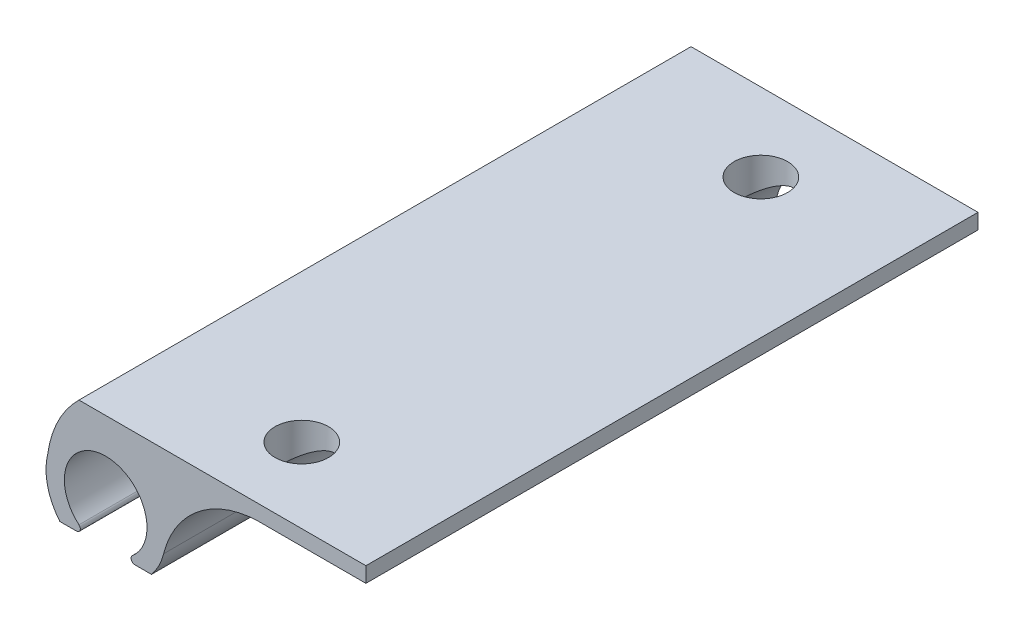
from build123d import *

# Parameters (mm, degrees)
EXTRUDE_1_DEPTH                            = 3.9
EXTRUDE_3_DEPTH                            = 20
EXTRUDE_5_DEPTH                            = 20
FILLET_1_R                                 = 0.25
FILLET_1_OF_MIRROR_2_R                     = 0.25
SKETCH_7_R                                 = 5.5
CUT_EXTRUDE_3_DEPTH                        = 69.146236458
MIRROR_3_AT_THE_SECOND_PLANE_COPY_1_SKET_R = 5.5
MIRROR_3_AT_THE_SECOND_PLANE_COPY_1_DEPTH  = 69.146236458
ESQUISSE1_W                                = 44.6
ESQUISSE1_H                                = 40
ENL_V_MAT_EXTRU_1_DEPTH                    = 1.54
ENL_V_MAT_EXTRU_2_DEPTH                    = 57.761068742
ESQUISSE3_W                                = 50
ESQUISSE3_H                                = 1.36
ENL_V_MAT_EXTRU_3_DEPTH                    = 64.372466761
ESQUISSE4_W                                = 27.815449133
ESQUISSE4_H                                = 40
ENL_V_MAT_EXTRU_4_DEPTH                    = 54.066651895
ESQUISSE5_R                                = 1.75
ENL_V_MAT_EXTRU_5_DEPTH                    = 54.198396436


with BuildPart() as part:
    # Эскиз1 → Бобышка-Вытянуть1 (new body)
    with BuildSketch(Plane(origin=(0, 0, 0), x_dir=(1, 0, 0), z_dir=(0, 1, 0))):
        with BuildLine():
            ThreePointArc((-44.6, -23.2), (-43.428427125, -26.028427125), (-40.6, -27.2))
            Line((-40.6, -27.2), (40.6, -27.2))
            ThreePointArc((40.6, -27.2), (43.428427125, -26.028427125), (44.6, -23.2))
            Line((44.6, -23.2), (44.6, 23.2))
            ThreePointArc((44.6, 23.2), (43.428427125, 26.028427125), (40.6, 27.2))
            Line((40.6, 27.2), (33.6, 27.2))
            Line((33.6, 27.2), (-5.4, 27.2))
            Line((-5.4, 27.2), (-40.6, 27.2))
            ThreePointArc((-40.6, 27.2), (-43.428427125, 26.028427125), (-44.6, 23.2))
            Line((-44.6, 23.2), (-44.6, -23.2))
        make_face()
    extrude(amount=EXTRUDE_1_DEPTH)



with BuildPart() as body_2:
    # Эскиз3 → Бобышка-Вытянуть3 (new, symmetric)
    with BuildSketch(Plane.XY):
        with BuildLine():
            Line((-47.815262386, -6.499919999), (-45.841869662, -6.499919999))
            ThreePointArc((-45.841869662, -6.499919999), (-44.821869662, -1.3), (-43.801869662, -6.499919999))
            Line((-43.801869662, -6.499919999), (-41.828476938, -6.499919999))
            ThreePointArc((-41.828476938, -6.499919999), (-44.821869662, -0.1), (-47.815262386, -6.499919999))
        make_face()
    extrude_3 = extrude(amount=EXTRUDE_3_DEPTH, both=True)


with BuildPart() as part_1:
    add(part.part)

    add(body_2.part)  # Бобышка-Вытянуть5 merges body 2
    # Эскиз5 → Бобышка-Вытянуть5 (add, symmetric)
    with BuildSketch(Plane.XY):
        with BuildLine():
            ThreePointArc((-41.631827579, 2.999901942), (-46.932438451, 0.61464415), (-48.60377877, -4.952451312))
            Line((-48.60377877, -4.952451312), (-47.348297278, -4.952451312))
            ThreePointArc((-47.348297278, -4.952451312), (-44.821869662, -1.3), (-42.295442046, -4.952451312))
            Line((-42.295442046, -4.952451312), (-41.039960555, -4.952451312))
            ThreePointArc((-41.039960555, -4.952451312), (-38.684888017, -1.351535806), (-34.6, 0))
            Line((-34.6, 0), (-36.641600827, 0.870983001))
            ThreePointArc((-36.641600827, 0.870983001), (-38.922074934, 2.438561027), (-41.631827579, 2.999901942))
        make_face()
    extrude_5 = extrude(amount=EXTRUDE_5_DEPTH, both=True)

    # Скругление1
    fillet_1_edges = [part_1.edges().sort_by_distance(p)[0] for p in [
        (-43.801869662, -6.499919999, 0),
        (-45.841869662, -6.499919999, 0),
    ]]
    fillet(fillet_1_edges, radius=FILLET_1_R)

    # Зеркальное отражение1: Бобышка-Вытянуть5 across plane
    add(extrude_5.mirror(Plane(origin=(0, 0, 0), x_dir=(0, 0, 1), z_dir=(1, 0, 0))))

    # Зеркальное отражение2: Бобышка-Вытянуть3 across plane
    add(extrude_3.mirror(Plane(origin=(0, 0, 0), x_dir=(0, 0, 1), z_dir=(1, 0, 0))))

    # Скругление1 of Зеркальное отражение2
    fillet_1_of_mirror_2_edges = [part_1.edges().sort_by_distance(p)[0] for p in [
        (43.801869662, -6.499919999, 0),
        (45.841869662, -6.499919999, 0),
    ]]
    fillet(fillet_1_of_mirror_2_edges, radius=FILLET_1_OF_MIRROR_2_R)

    # Эскиз7 → Вырез-Вытянуть3 (cut, through all)
    with BuildSketch(Plane.XY.offset(20)):
        with Locations((-45, -4)):
            Circle(SKETCH_7_R)
    cut_extrude_3 = extrude(amount=CUT_EXTRUDE_3_DEPTH, mode=Mode.SUBTRACT)

    # Зеркальное отражение3: Вырез-Вытянуть3 across plane
    add(cut_extrude_3.mirror(Plane(origin=(0, 0, 0), x_dir=(0, 0, 1), z_dir=(1, 0, 0))), mode=Mode.SUBTRACT)

    # Зеркальное отражение3 at the second plane: Вырез-Вытянуть3 across plane
    add(cut_extrude_3.mirror(Plane.XY), mode=Mode.SUBTRACT)

    # Зеркальное отражение3 at the second plane copy 1 sket → Зеркальное отражение3 at the second plane copy 1 (cut, through all)
    with BuildSketch(Plane(origin=(0, 0, -20), x_dir=(-1, 0, 0), z_dir=(0, 0, -1))):
        with Locations((-45, -4)):
            Circle(MIRROR_3_AT_THE_SECOND_PLANE_COPY_1_SKET_R)
    extrude(amount=MIRROR_3_AT_THE_SECOND_PLANE_COPY_1_DEPTH, mode=Mode.SUBTRACT)

    # Esquisse1 → Enlèv. mat.-Extru.1 (cut)
    with BuildSketch(Plane(origin=(0, 3.9, 0), x_dir=(1, 0, 0), z_dir=(0, 1, 0))):
        with Locations((-22.3, 0)):
            Rectangle(ESQUISSE1_W, ESQUISSE1_H)
    extrude(amount=-ENL_V_MAT_EXTRU_1_DEPTH, mode=Mode.SUBTRACT)

    # Esquisse2 → Enlèv. mat.-Extru.2 (cut, through all)
    with BuildSketch(Plane(origin=(0, 3.9, 0), x_dir=(1, 0, 0), z_dir=(0, 1, 0))):
        Polygon((-44.6, 20), (-44.6, 27.2), (51.6, 27.2), (51.6, -27.2), (-44.6, -27.2), (-44.6, -20), (0, -20), (0, 20), align=None)
    extrude(amount=-ENL_V_MAT_EXTRU_2_DEPTH, mode=Mode.SUBTRACT)

    # Esquisse3 → Enlèv. mat.-Extru.3 (cut, through all)
    with BuildSketch(Plane.XY.offset(20)):
        with Locations((-25, 1.68)):
            Rectangle(ESQUISSE3_W, ESQUISSE3_H)
    extrude(amount=-ENL_V_MAT_EXTRU_3_DEPTH, mode=Mode.SUBTRACT)

    # Esquisse4 → Enlèv. mat.-Extru.4 (cut, through all)
    with BuildSketch(Plane.XZ):
        with Locations((-13.907724567, 0)):
            Rectangle(ESQUISSE4_W, ESQUISSE4_H)
    extrude(amount=-ENL_V_MAT_EXTRU_4_DEPTH, mode=Mode.SUBTRACT)

    # Esquisse5 → Enlèv. mat.-Extru.5 (cut, through all)
    with BuildSketch(Plane(origin=(0, 1, 0), x_dir=(1, 0, 0), z_dir=(0, 1, 0))):
        with Locations((-36.905449133, 14.9)):
            Circle(ESQUISSE5_R)
        with Locations((-36.905449133, -15.1)):
            Circle(ESQUISSE5_R)
    extrude(amount=-ENL_V_MAT_EXTRU_5_DEPTH, mode=Mode.SUBTRACT)


solid = part_1.part
